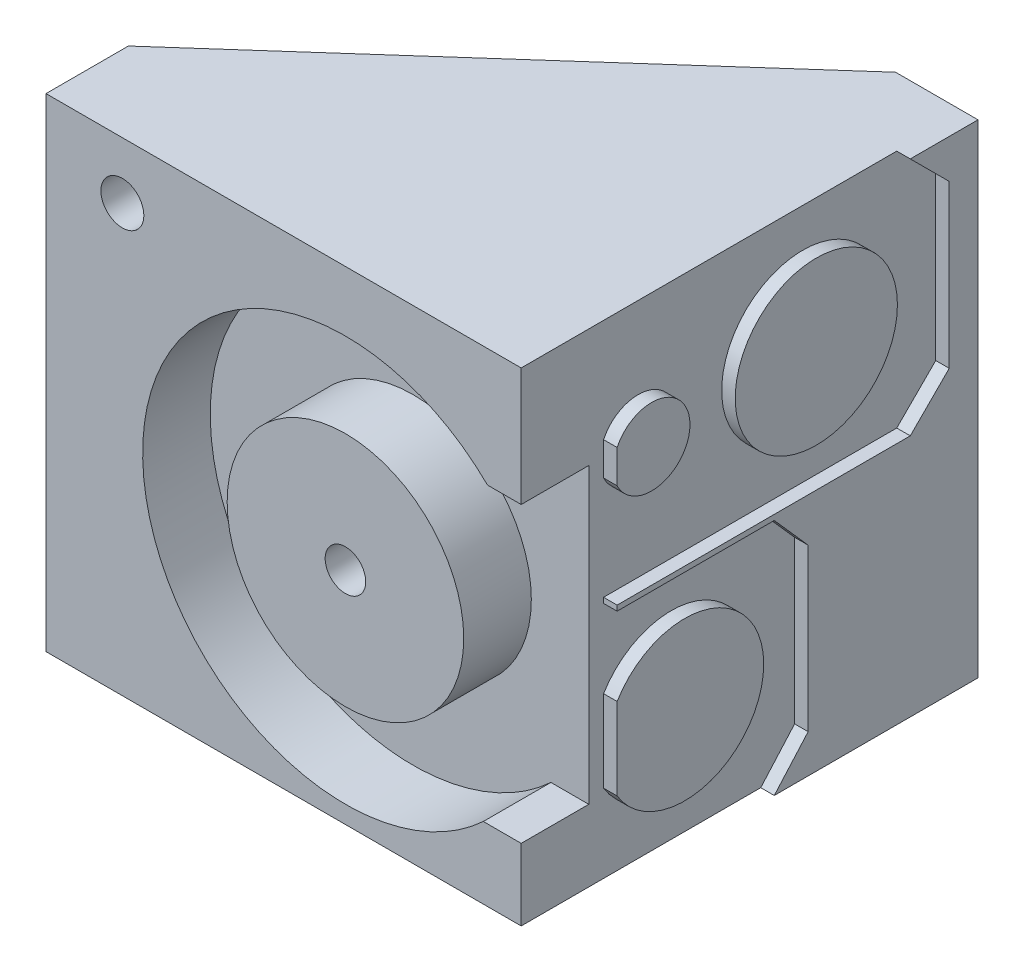
from build123d import *

# Parameters (mm, degrees)
CROQUIS1_W                 = 72.3
CROQUIS1_H                 = 65.58
SALIENTE_EXTRUIR1_DEPTH    = 35.75
CROQUIS2_R                 = 12
CORTAR_EXTRUIR1_DEPTH      = 2
CROQUIS3_R                 = 17.5
CROQUIS3_R_2               = 3
CORTAR_EXTRUIR2_DEPTH      = 10
CORTAR_EXTRUIR3_DEPTH      = 61.49850494
CORTAR_EXTRUIR3_DEPTH_BACK = 61.49850494
CORTAR_EXTRUIR4_DEPTH      = 31
CROQUIS3_3_R               = 3.175
CORTAR_EXTRUIR5_DEPTH      = 83.979644492


with BuildPart() as part:
    # Croquis1 → Saliente-Extruir1 (new, symmetric)
    with BuildSketch(Plane(origin=(0, 0, 0), x_dir=(1, 0, 0), z_dir=(0, 1, 0))):
        Rectangle(CROQUIS1_W, CROQUIS1_H)
    extrude(amount=SALIENTE_EXTRUIR1_DEPTH, both=True)

    # Croquis2 → Cortar-Extruir1 (cut)
    with BuildSketch(Plane(origin=(36.15, 0, 0), x_dir=(0, 0, -1), z_dir=(1, 0, 0))):
        Polygon((-20.6, -0.51), (-20.6, 0.27), (22.77, 0.27), (28.535, 6.035), (28.535, 29.985), (22.77, 35.75), (-32.79, 35.75), (-32.79, -35.75), (2.65, -35.75), (7.66, -30.08), (7.66, -6.18), (2.65, -0.51), align=None)
        with BuildLine():
            Line((-20.6, 15.553009972), (-20.6, 20.466990028))
            ThreePointArc((-20.6, 20.466990028), (-9.82, 18.01), (-20.6, 15.553009972))
        make_face(mode=Mode.SUBTRACT)
        with BuildLine():
            Line((-20.6, -24.184428132), (-20.6, -12.075571868))
            ThreePointArc((-20.6, -12.075571868), (1.09, -18.13), (-20.6, -24.184428132))
        make_face(mode=Mode.SUBTRACT)
        with Locations((8.87, 18.01)):
            Circle(CROQUIS2_R, mode=Mode.SUBTRACT)
    extrude(amount=-CORTAR_EXTRUIR1_DEPTH, mode=Mode.SUBTRACT)

    # Croquis3 → Cortar-Extruir2 (cut)
    # profile 1 of 2: a face of its own
    with BuildSketch(Plane.XY.offset(32.79)):
        with BuildLine():
            Line((34.15, -25.16), (34.15, 18.25))
            Line((34.15, 18.25), (29.164563997, 18.25))
            ThreePointArc((29.164563997, 18.25), (-21.846955575, -2.732617016), (28.546078054, -25.16))
            Line((28.546078054, -25.16), (34.15, -25.16))
        make_face()
        with Locations((8.15, -3.16)):
            Circle(CROQUIS3_R, mode=Mode.SUBTRACT)
    # profile 2 of 2: a face of its own
    with BuildSketch(Plane.XY.offset(32.79)):
        with Locations((8.15, -3.16)):
            Circle(CROQUIS3_R_2)
    extrude(amount=-CORTAR_EXTRUIR2_DEPTH, mode=Mode.SUBTRACT)

    # Croquis4 → Cortar-Extruir3 (cut, two sides: drawn at the far end of the back side and taken through both)
    with BuildSketch(Plane(origin=(0, 0, 0), x_dir=(1, 0, 0), z_dir=(0, 1, 0)).offset(-CORTAR_EXTRUIR3_DEPTH_BACK)):
        Polygon((-36.15, 32.79), (23.958, 32.79), (-36.15, -20.6), align=None)
    extrude(amount=CORTAR_EXTRUIR3_DEPTH + CORTAR_EXTRUIR3_DEPTH_BACK, mode=Mode.SUBTRACT)

    # Croquis5 → Cortar-Extruir4 (cut, symmetric)
    with BuildSketch(Plane(origin=(0, 0, 0), x_dir=(1, 0, 0), z_dir=(0, 1, 0))):
        Polygon((23.958, 32.79), (23.958, -20.6), (-36.15, -20.6), align=None)
    extrude(amount=CORTAR_EXTRUIR4_DEPTH, both=True, mode=Mode.SUBTRACT)

    # Croquis3<3> → Cortar-Extruir5 (cut, through all)
    with BuildSketch(Plane.XY.offset(32.79)):
        with Locations((-24.852904541, 27.365641017)):
            Circle(CROQUIS3_3_R)
    extrude(amount=-CORTAR_EXTRUIR5_DEPTH, mode=Mode.SUBTRACT)


solid = part.part
